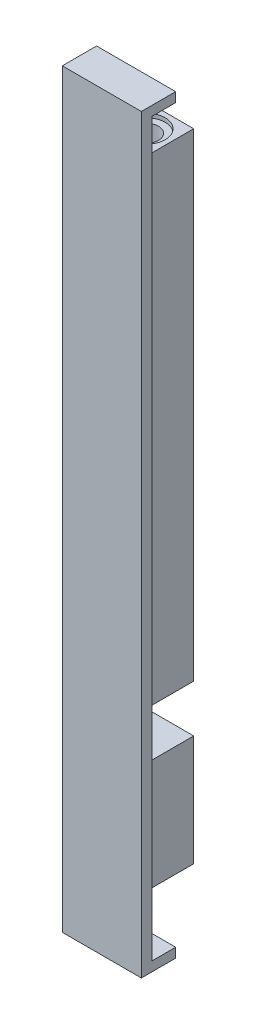
from build123d import *

# Parameters (mm, degrees)
BOSS_EXTRUDE2_DEPTH             = 80.5
BOSS_EXTRUDE3_DEPTH             = 90.5
SKETCH7_W                       = 37.5
SKETCH7_H                       = 6
SKETCH9_R                       = 1.55
CUT_EXTRUDE4_DEPTH              = 4.3
SKETCH10_R                      = 2.4
CUT_EXTRUDE5_DEPTH              = 0.5
SKETCH13_R                      = 2.4
CUT_EXTRUDE6_DEPTH              = 0.5
SKETCH14_R                      = 1.55
CUT_EXTRUDE7_DEPTH              = 4.3
SKIZZE1_W                       = 10
SKIZZE1_H                       = 1.339950219
AUFSATZ_LINEAR_AUSTRAGEN1_DEPTH = 2.2
SKIZZE2_W                       = 10
SKIZZE2_H                       = 1.2
AUFSATZ_LINEAR_AUSTRAGEN2_DEPTH = 3
SKIZZE3_W                       = 10
SKIZZE3_H                       = 1.339950219
AUFSATZ_LINEAR_AUSTRAGEN3_DEPTH = 2.2
SKIZZE4_W                       = 10
SKIZZE4_H                       = 1.2
AUFSATZ_LINEAR_AUSTRAGEN4_DEPTH = 3


with BuildPart() as part:
    # Sketch3 → Boss-Extrude2 (new body)
    with BuildSketch(Plane.XZ.offset(5)):
        with BuildLine():
            Line((-3, 37.379807383), (-3, 31.379807383))
            Line((-3, 31.379807383), (3, 31.379807383))
            Line((3, 31.379807383), (3, 37.379807383))
            ThreePointArc((3, 37.379807383), (0, 37.5), (-3, 37.379807383))
        make_face()
    extrude(amount=BOSS_EXTRUDE2_DEPTH)

    # Sketch5 → Boss-Extrude3 (add)
    with BuildSketch(Plane(origin=(0, 0, 0), x_dir=(1, 0, 0), z_dir=(0, 1, 0))):
        with BuildLine():
            Line((-5, -38.661160244), (-5, -39.236412732))
            Line((-5, -39.236412732), (-5, -40.001110463))
            Line((-5, -40.001110463), (0, -40.001110463))
            Line((0, -40.001110463), (5, -40.001110463))
            Line((5, -40.001110463), (5, -39.666036217))
            Line((5, -39.666036217), (5, -38.661160244))
            ThreePointArc((5, -38.661160244), (3.50261559, -38.825468387), (2.00000116, -38.931803282))
            Line((2.00000116, -38.931803282), (2.00000116, -37.431803282))
            ThreePointArc((2.00000116, -37.431803282), (0, -37.485195766), (-2.00000116, -37.431803282))
            Line((-2.00000116, -37.431803282), (-2.00000116, -38.931803282))
            ThreePointArc((-2.00000116, -38.931803282), (-3.50261559, -38.825468387), (-5, -38.661160244))
        make_face()
    extrude(amount=-BOSS_EXTRUDE3_DEPTH)

    # Sketch7 → Cut-Revolve1 (revolve, cut)
    with BuildSketch(Plane(origin=(0, 0, 0), x_dir=(0, 0, -1), z_dir=(1, 0, 0))):
        with Locations((-18.75, -68.5)):
            Rectangle(SKETCH7_W, SKETCH7_H)
    revolve(axis=Axis((0, -27.016689378, 0), (0, -1, 0)), mode=Mode.SUBTRACT)

    # Sketch9 → Cut-Extrude4 (cut)
    with BuildSketch(Plane(origin=(0, -85.5, 0), x_dir=(-1, 0, 0), z_dir=(0, -1, 0))):
        with Locations((0, -34.420864201)):
            Circle(SKETCH9_R)
    extrude(amount=-CUT_EXTRUDE4_DEPTH, mode=Mode.SUBTRACT)

    # Sketch10 → Cut-Extrude5 (cut)
    with BuildSketch(Plane(origin=(0, -85.5, 0), x_dir=(-1, 0, 0), z_dir=(0, -1, 0))):
        with Locations((0, -34.420864201)):
            Circle(SKETCH10_R)
    extrude(amount=-CUT_EXTRUDE5_DEPTH, mode=Mode.SUBTRACT)

    # Sketch13 → Cut-Extrude6 (cut)
    with BuildSketch(Plane(origin=(0, -5, 0), x_dir=(-1, 0, 0), z_dir=(0, -1, 0))):
        with Locations((0, -34.379807383)):
            Circle(SKETCH13_R)
    extrude(amount=CUT_EXTRUDE6_DEPTH, mode=Mode.SUBTRACT)

    # Sketch14 → Cut-Extrude7 (cut)
    with BuildSketch(Plane(origin=(0, -5, 0), x_dir=(-1, 0, 0), z_dir=(0, -1, 0))):
        with Locations((0, -34.379807383)):
            Circle(SKETCH14_R)
    extrude(amount=CUT_EXTRUDE7_DEPTH, mode=Mode.SUBTRACT)

    # Skizze1 → Aufsatz-Linear austragen1 (add)
    with BuildSketch(Plane(origin=(0, 0, 0), x_dir=(1, 0, 0), z_dir=(0, 1, 0))):
        with Locations((0, -39.331135354)):
            Rectangle(SKIZZE1_W, SKIZZE1_H)
    extrude(amount=AUFSATZ_LINEAR_AUSTRAGEN1_DEPTH)

    # Skizze2 → Aufsatz-Linear austragen2 (add)
    with BuildSketch(Plane(origin=(0, 0, 38.661160244), x_dir=(-1, 0, 0), z_dir=(0, 0, -1))):
        with Locations((0, 1.6)):
            Rectangle(SKIZZE2_W, SKIZZE2_H)
    extrude(amount=AUFSATZ_LINEAR_AUSTRAGEN2_DEPTH)

    # Skizze3 → Aufsatz-Linear austragen3 (add)
    with BuildSketch(Plane.XZ.offset(90.5)):
        with Locations((0, 39.331135354)):
            Rectangle(SKIZZE3_W, SKIZZE3_H)
    extrude(amount=AUFSATZ_LINEAR_AUSTRAGEN3_DEPTH)

    # Skizze4 → Aufsatz-Linear austragen4 (add)
    with BuildSketch(Plane(origin=(0, 0, 38.661160244), x_dir=(-1, 0, 0), z_dir=(0, 0, -1))):
        with Locations((0, -92.1)):
            Rectangle(SKIZZE4_W, SKIZZE4_H)
    extrude(amount=AUFSATZ_LINEAR_AUSTRAGEN4_DEPTH)


solid = part.part
